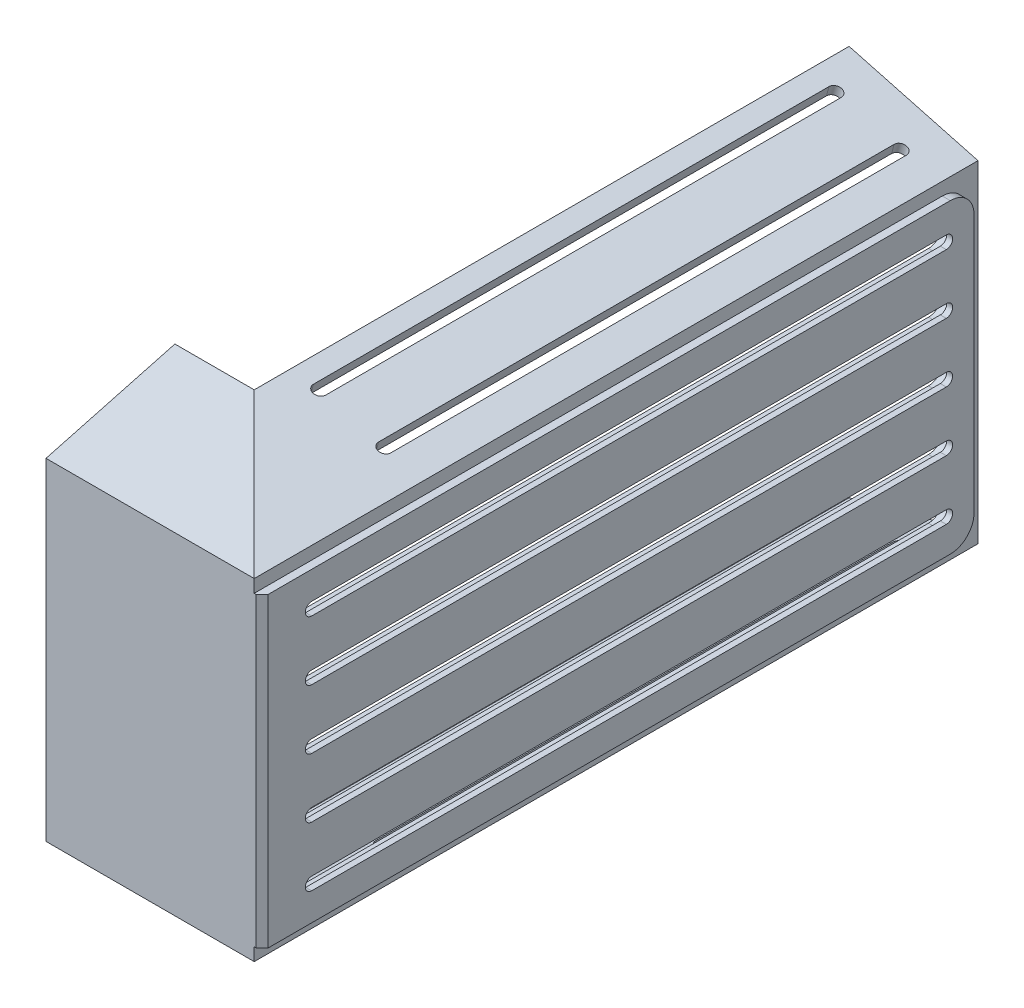
from build123d import *

# Parameters (mm, degrees)
CUT_EXTRUDE1_DEPTH  = 194.530714703
SKETCH7_W           = 174
SKETCH7_H           = 77.2
BOSS_EXTRUDE1_DEPTH = 2
CUT_EXTRUDE2_DEPTH  = 3
FILLET1_R           = 6
CHAMFER1_SIZE       = 6
CUT_EXTRUDE3_REACH  = 213.158


with BuildPart() as part:
    # Sweep1: sweep along a path in Sketch2
    with BuildLine(Plane(origin=(0, 0, 0), x_dir=(1, 0, 0), z_dir=(0, 1, 0))) as sweep1_path:
        Line((0, 0), (50, 0))
        Line((50, 0), (50, 180))
    # Sketch4 → Sweep1 (sweep)
    with BuildSketch(Plane(origin=(0, 0, 0), x_dir=(0, 0, -1), z_dir=(1, 0, 0))):
        Polygon((0, -40), (0, 40), (30, 48.038475773), (30, 50.538475773), (-2.5, 41.830127019), (-2.5, -41.830127019), (30, -50.538475773), (30, -48.038475773), align=None)
    sweep(path=sweep1_path.line, transition=Transition.RIGHT)

    # Sketch6 → Cut-Extrude1 (cut, through all)
    with BuildSketch(Plane.ZY.offset(-50)):
        with BuildLine():
            Line((-10, 28.4), (-170, 28.4))
            ThreePointArc((-170, 28.4), (-171.6, 30), (-170, 31.6))
            Line((-170, 31.6), (-10, 31.6))
            ThreePointArc((-10, 31.6), (-8.4, 30), (-10, 28.4))
        make_face()
        with BuildLine():
            Line((-10, -1.6), (-170, -1.6))
            ThreePointArc((-170, -1.6), (-171.6, 0), (-170, 1.6))
            Line((-170, 1.6), (-10, 1.6))
            ThreePointArc((-10, 1.6), (-8.4, 0), (-10, -1.6))
        make_face()
        with BuildLine():
            Line((-10, -31.6), (-170, -31.6))
            ThreePointArc((-170, -31.6), (-171.6, -30), (-170, -28.4))
            Line((-170, -28.4), (-10, -28.4))
            ThreePointArc((-10, -28.4), (-8.4, -30), (-10, -31.6))
        make_face()
        with BuildLine():
            Line((-10, -16.6), (-170, -16.6))
            ThreePointArc((-170, -16.6), (-171.6, -15), (-170, -13.4))
            Line((-170, -13.4), (-10, -13.4))
            ThreePointArc((-10, -13.4), (-8.4, -15), (-10, -16.6))
        make_face()
        with BuildLine():
            Line((-10, 13.4), (-170, 13.4))
            ThreePointArc((-170, 13.4), (-171.6, 15), (-170, 16.6))
            Line((-170, 16.6), (-10, 16.6))
            ThreePointArc((-10, 16.6), (-8.4, 15), (-10, 13.4))
        make_face()
    extrude(amount=-CUT_EXTRUDE1_DEPTH, mode=Mode.SUBTRACT)

    # Sketch7 → Boss-Extrude1 (add)
    with BuildSketch(Plane(origin=(52.5, 0, 0), x_dir=(0, 0, -1), z_dir=(1, 0, 0))):
        with Locations((90, 0)):
            Rectangle(SKETCH7_W, SKETCH7_H)
        with BuildLine():
            Line((170, -31.6), (10, -31.6))
            ThreePointArc((10, -31.6), (8.4, -30), (10, -28.4))
            Line((10, -28.4), (170, -28.4))
            ThreePointArc((170, -28.4), (171.6, -30), (170, -31.6))
        make_face(mode=Mode.SUBTRACT)
        with BuildLine():
            Line((170, -16.6), (10, -16.6))
            ThreePointArc((10, -16.6), (8.4, -15), (10, -13.4))
            Line((10, -13.4), (170, -13.4))
            ThreePointArc((170, -13.4), (171.6, -15), (170, -16.6))
        make_face(mode=Mode.SUBTRACT)
        with BuildLine():
            Line((10, 1.6), (170, 1.6))
            ThreePointArc((170, 1.6), (171.6, 0), (170, -1.6))
            Line((170, -1.6), (10, -1.6))
            ThreePointArc((10, -1.6), (8.4, 0), (10, 1.6))
        make_face(mode=Mode.SUBTRACT)
        with BuildLine():
            Line((170, 13.4), (10, 13.4))
            ThreePointArc((10, 13.4), (8.4, 15), (10, 16.6))
            Line((10, 16.6), (170, 16.6))
            ThreePointArc((170, 16.6), (171.6, 15), (170, 13.4))
        make_face(mode=Mode.SUBTRACT)
        with BuildLine():
            Line((170, 28.4), (10, 28.4))
            ThreePointArc((10, 28.4), (8.4, 30), (10, 31.6))
            Line((10, 31.6), (170, 31.6))
            ThreePointArc((170, 31.6), (171.6, 30), (170, 28.4))
        make_face(mode=Mode.SUBTRACT)
    extrude(amount=BOSS_EXTRUDE1_DEPTH)

    # Sketch9 → Cut-Extrude2 (cut)
    with BuildSketch(Plane.ZY.offset(-50)):
        with BuildLine():
            Line((-170, 33.6), (-10, 33.6))
            ThreePointArc((-10, 33.6), (-6.4, 30), (-10, 26.4))
            Line((-10, 26.4), (-170, 26.4))
            ThreePointArc((-170, 26.4), (-173.6, 30), (-170, 33.6))
        make_face()
        with BuildLine():
            Line((-170, 18.6), (-10, 18.6))
            ThreePointArc((-10, 18.6), (-6.4, 15), (-10, 11.4))
            Line((-10, 11.4), (-170, 11.4))
            ThreePointArc((-170, 11.4), (-173.6, 15), (-170, 18.6))
        make_face()
        with BuildLine():
            Line((-170, 3.6), (-10, 3.6))
            ThreePointArc((-10, 3.6), (-6.4, 0), (-10, -3.6))
            Line((-10, -3.6), (-170, -3.6))
            ThreePointArc((-170, -3.6), (-173.6, 0), (-170, 3.6))
        make_face()
        with BuildLine():
            Line((-170, -11.4), (-10, -11.4))
            ThreePointArc((-10, -11.4), (-6.4, -15), (-10, -18.6))
            Line((-10, -18.6), (-170, -18.6))
            ThreePointArc((-170, -18.6), (-173.6, -15), (-170, -11.4))
        make_face()
        with BuildLine():
            Line((-170, -26.4), (-10, -26.4))
            ThreePointArc((-10, -26.4), (-6.4, -30), (-10, -33.6))
            Line((-10, -33.6), (-170, -33.6))
            ThreePointArc((-170, -33.6), (-173.6, -30), (-170, -26.4))
        make_face()
    extrude(amount=-CUT_EXTRUDE2_DEPTH, mode=Mode.SUBTRACT)

    # Fillet1
    fillet1_edges = [part.edges().sort_by_distance(p)[0] for p in [
        (53.5, -38.6, -177),
        (53.5, 38.6, -177),
    ]]
    fillet(fillet1_edges, radius=FILLET1_R)

    # Chamfer1
    # the kernel refuses this chamfer: 6 mm, written as the material it adds along each edge
    with BuildSketch(Plane(origin=(52.5, -38.6, -3), x_dir=(-0.02749587661058908, 0, 0.9996219169112968), z_dir=(0, 1, 0))) as chamfer1_piece_1_section:
        Polygon((CHAMFER1_SIZE * 0.999621916911, CHAMFER1_SIZE * 0.0274958766106), (-CHAMFER1_SIZE * 0.0274958766106, CHAMFER1_SIZE * 0.999621916911), (0, 0), align=None)
    chamfer1_piece_1 = extrude(amount=77.2, mode=Mode.PRIVATE)
    chamfer1_piece_1 = split(chamfer1_piece_1, bisect_by=Plane(origin=(53.373608637, 0, 2.5), z_dir=(0, 0, -1)), keep=Keep.TOP, mode=Mode.PRIVATE)
    chamfer1_piece_1 = split(chamfer1_piece_1, bisect_by=Plane(origin=(54.5, 0, -0.51208469), z_dir=(-1, 0, 0)), keep=Keep.TOP, mode=Mode.PRIVATE)
    add(chamfer1_piece_1)

    # Sketch10 → Cut-Extrude3 (cut, up to next)
    with BuildSketch(Plane(origin=(13.974364905, 52.15303983, 0), x_dir=(0.9659258262890679, -0.25881904510252257, 0), z_dir=(0.2588190451025226, 0.9659258262890679, 0)), mode=Mode.PRIVATE) as cut_extrude3_sk1:
        with BuildLine():
            Line((14.538196485, 170), (14.538196485, 40))
            ThreePointArc((14.538196485, 40), (12.938196485, 38.4), (11.338196485, 40))
            Line((11.338196485, 40), (11.338196485, 170))
            ThreePointArc((11.338196485, 170), (12.938196485, 171.6), (14.538196485, 170))
        make_face()
    cut_extrude3_tool1 = extrude(cut_extrude3_sk1.sketch, amount=-CUT_EXTRUDE3_REACH, mode=Mode.PRIVATE) & part.part
    # Sketch10 → Cut-Extrude3 (cut, up to next)
    with BuildSketch(Plane(origin=(13.974364905, 52.15303983, 0), x_dir=(0.9659258262890679, -0.25881904510252257, 0), z_dir=(0.2588190451025226, 0.9659258262890679, 0)), mode=Mode.PRIVATE) as cut_extrude3_sk2:
        with BuildLine():
            Line((31.538196485, 170), (31.538196485, 40))
            ThreePointArc((31.538196485, 40), (29.938196485, 38.4), (28.338196485, 40))
            Line((28.338196485, 40), (28.338196485, 170))
            ThreePointArc((28.338196485, 170), (29.938196485, 171.6), (31.538196485, 170))
        make_face()
    cut_extrude3_tool2 = extrude(cut_extrude3_sk2.sketch, amount=-CUT_EXTRUDE3_REACH, mode=Mode.PRIVATE) & part.part
    cut_extrude3_1 = cut_extrude3_tool1.solids().sort_by_distance((26.471703, 48.804388, -105))[0]
    add(cut_extrude3_1, mode=Mode.SUBTRACT)
    cut_extrude3_2 = cut_extrude3_tool2.solids().sort_by_distance((42.892442, 44.404464, -105))[0]
    add(cut_extrude3_2, mode=Mode.SUBTRACT)
    cut_extrude3 = cut_extrude3_1 + cut_extrude3_2  # Cut-Extrude3 as one shape, for the pattern or mirror that repeats it

    # Mirror1: Cut-Extrude3 across plane
    add(cut_extrude3.mirror(Plane.ZX), mode=Mode.SUBTRACT)


solid = part.part
